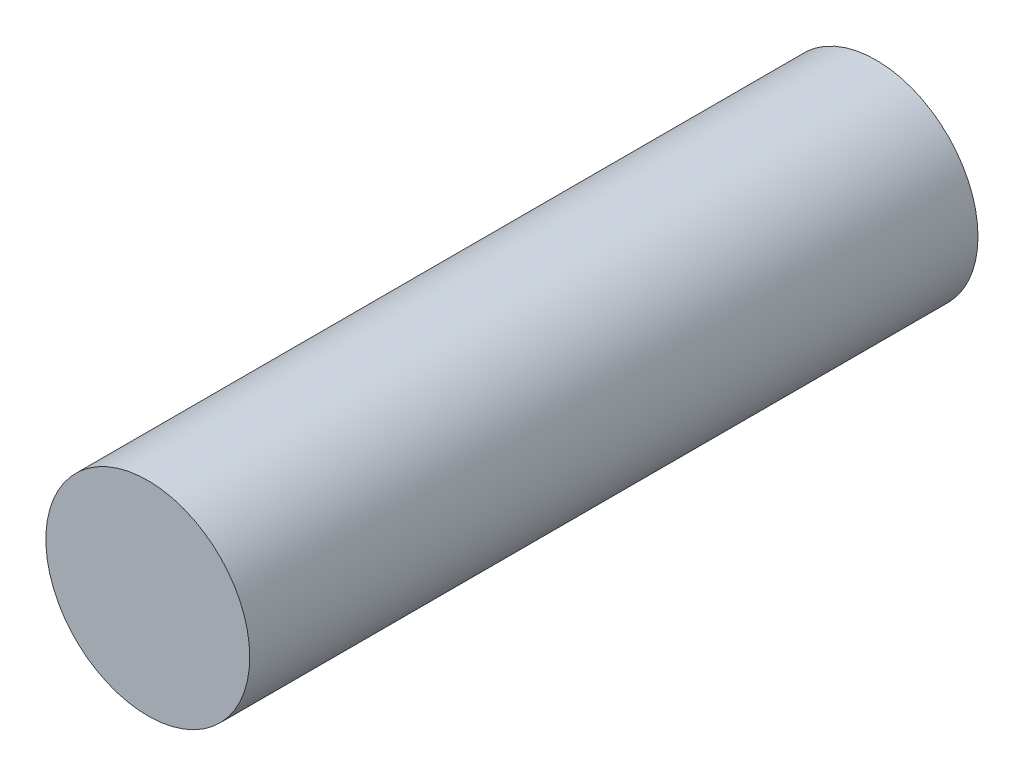
from build123d import *

# Parameters (mm, degrees)
SKETCH1_R           = 35
BOSS_EXTRUDE1_DEPTH = 250
SKETCH2_R           = 35
BOSS_EXTRUDE2_DEPTH = 250


with BuildPart() as part:
    # Sketch1 → Boss-Extrude1 (new body)
    with BuildSketch(Plane.XY):
        Circle(SKETCH1_R)
    extrude(amount=BOSS_EXTRUDE1_DEPTH)

    # Sketch2 → Boss-Extrude2 (add)
    with BuildSketch(Plane.XY):
        Circle(SKETCH2_R)
    extrude(amount=BOSS_EXTRUDE2_DEPTH)


solid = part.part
